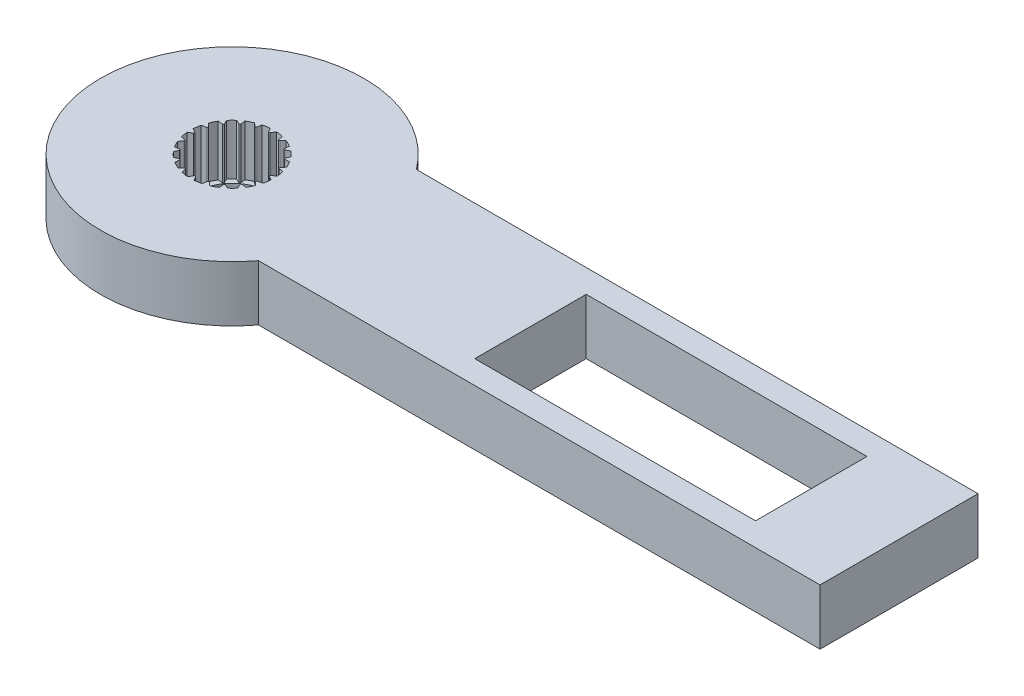
from build123d import *

# Parameters (mm, degrees)
SKETCH1_R             = 2
SKETCH1_W             = 16
SKETCH1_H             = 6.35
BOSS_EXTRUDE1_DEPTH   = 3.175
INDENT2_START         = 0.275
INDENT2_OUTLINE_R     = 2
INDENT2_DEPTH         = 2.9
INDENT2_2_OUTLINE_R   = 2.075
INDENT2_2_OUTLINE_R_2 = 2
INDENT2_2_DEPTH       = 0.275
FILLET4_R             = 0.05


# Read off the part's stored shape, not the designer's step: Indent2
with BuildPart() as part:
    # Sketch1 → Boss-Extrude1 (new body)
    with BuildSketch(Plane(origin=(0, 0, 0), x_dir=(1, 0, 0), z_dir=(0, 1, 0))):
        with BuildLine():
            Line((6, 4.5), (38, 4.5))
            Line((38, 4.5), (38, -4.5))
            Line((38, -4.5), (6, -4.5))
            ThreePointArc((6, -4.5), (-7.5, 0), (6, 4.5))
        make_face()
        with Locations(Location((0, 0, 0), (0, 0, 270))):
            Circle(SKETCH1_R, mode=Mode.SUBTRACT)
        with Locations((25, 0)):
            Rectangle(SKETCH1_W, SKETCH1_H, mode=Mode.SUBTRACT)
    extrude(amount=BOSS_EXTRUDE1_DEPTH)

    # Indent2 outline → Indent2 (cut)
    with BuildSketch(Plane(origin=(0, 0, 0), x_dir=(1, 0, 0), z_dir=(0, 1, 0)).offset(INDENT2_START)):
        with BuildLine():
            Line((1.973202198, -0.621873827), (2.310555802, -0.549506038))
            ThreePointArc((2.310555802, -0.549506038), (2.348957068, -0.350750187), (2.370293408, -0.149446173))
            Line((2.370293408, -0.149446173), (2.068796389, 0.018315857))
            Line((2.068796389, 0.018315857), (2.367275856, 0.191389711))
            ThreePointArc((2.367275856, 0.191389711), (2.342378694, 0.392284402), (2.300464399, 0.590329188))
            Line((2.300464399, 0.590329188), (1.961882375, 0.656712657))
            Line((1.961882375, 0.656712657), (2.192270455, 0.913550902))
            ThreePointArc((2.192270455, 0.913550902), (2.106511974, 1.096919461), (2.005449906, 1.272319015))
            Line((2.005449906, 1.272319015), (1.662925646, 1.230825847))
            Line((1.662925646, 1.230825847), (1.802670348, 1.546287365))
            ThreePointArc((1.802670348, 1.546287365), (1.664445185, 1.6941804), (1.514128003, 1.829765392))
            Line((1.514128003, 1.829765392), (1.201190168, 1.684457227))
            Line((1.201190168, 1.684457227), (1.236612307, 2.027662448))
            ThreePointArc((1.236612307, 2.027662448), (1.059450904, 2.125603157), (0.874592702, 2.208101584))
            Line((0.874592702, 2.208101584), (0.621873827, 1.973202197))
            Line((0.621873827, 1.973202197), (0.549506038, 2.310555802))
            ThreePointArc((0.549506038, 2.310555802), (0.350750187, 2.348957068), (0.149446173, 2.370293408))
            Line((0.149446173, 2.370293408), (-0.018315857, 2.068796389))
            Line((-0.018315857, 2.068796389), (-0.191389711, 2.367275856))
            ThreePointArc((-0.191389711, 2.367275856), (-0.392284402, 2.342378694), (-0.590329188, 2.300464399))
            Line((-0.590329188, 2.300464399), (-0.656712657, 1.961882375))
            Line((-0.656712657, 1.961882375), (-0.913550902, 2.192270455))
            ThreePointArc((-0.913550902, 2.192270455), (-1.096919461, 2.106511974), (-1.272319015, 2.005449905))
            Line((-1.272319015, 2.005449905), (-1.230825847, 1.662925646))
            Line((-1.230825847, 1.662925646), (-1.546287365, 1.802670348))
            ThreePointArc((-1.546287365, 1.802670348), (-1.6941804, 1.664445185), (-1.829765392, 1.514128003))
            Line((-1.829765392, 1.514128003), (-1.684457227, 1.201190168))
            Line((-1.684457227, 1.201190168), (-2.027662448, 1.236612307))
            ThreePointArc((-2.027662448, 1.236612307), (-2.125603157, 1.059450904), (-2.208101584, 0.874592702))
            Line((-2.208101584, 0.874592702), (-1.973202197, 0.621873827))
            Line((-1.973202197, 0.621873827), (-2.310555802, 0.549506038))
            ThreePointArc((-2.310555802, 0.549506038), (-2.348957068, 0.350750187), (-2.370293408, 0.149446173))
            Line((-2.370293408, 0.149446173), (-2.068796389, -0.018315857))
            Line((-2.068796389, -0.018315857), (-2.367275856, -0.191389711))
            ThreePointArc((-2.367275856, -0.191389711), (-2.342378694, -0.392284402), (-2.300464399, -0.590329188))
            Line((-2.300464399, -0.590329188), (-1.961882375, -0.656712657))
            Line((-1.961882375, -0.656712657), (-2.192270455, -0.913550902))
            ThreePointArc((-2.192270455, -0.913550902), (-2.106511974, -1.096919461), (-2.005449905, -1.272319015))
            Line((-2.005449905, -1.272319015), (-1.662925646, -1.230825847))
            Line((-1.662925646, -1.230825847), (-1.802670348, -1.546287365))
            ThreePointArc((-1.802670348, -1.546287365), (-1.664445185, -1.6941804), (-1.514128003, -1.829765392))
            Line((-1.514128003, -1.829765392), (-1.201190168, -1.684457227))
            Line((-1.201190168, -1.684457227), (-1.236612307, -2.027662448))
            ThreePointArc((-1.236612307, -2.027662448), (-1.059450904, -2.125603157), (-0.874592702, -2.208101584))
            Line((-0.874592702, -2.208101584), (-0.621873827, -1.973202198))
            Line((-0.621873827, -1.973202198), (-0.549506038, -2.310555802))
            ThreePointArc((-0.549506038, -2.310555802), (-0.350750187, -2.348957068), (-0.149446173, -2.370293408))
            Line((-0.149446173, -2.370293408), (0.018315857, -2.068796389))
            Line((0.018315857, -2.068796389), (0.191389711, -2.367275856))
            ThreePointArc((0.191389711, -2.367275856), (0.392284402, -2.342378694), (0.590329188, -2.300464399))
            Line((0.590329188, -2.300464399), (0.656712657, -1.961882375))
            Line((0.656712657, -1.961882375), (0.913550902, -2.192270455))
            ThreePointArc((0.913550902, -2.192270455), (1.096919461, -2.106511974), (1.272319015, -2.005449906))
            Line((1.272319015, -2.005449906), (1.230825847, -1.662925646))
            Line((1.230825847, -1.662925646), (1.546287365, -1.802670348))
            ThreePointArc((1.546287365, -1.802670348), (1.6941804, -1.664445185), (1.829765392, -1.514128003))
            Line((1.829765392, -1.514128003), (1.684457227, -1.201190168))
            Line((1.684457227, -1.201190168), (2.027662448, -1.236612307))
            ThreePointArc((2.027662448, -1.236612307), (2.125603157, -1.059450904), (2.208101584, -0.874592702))
            Line((2.208101584, -0.874592702), (1.973202198, -0.621873827))
        make_face()
        Circle(INDENT2_OUTLINE_R, mode=Mode.SUBTRACT)
    extrude(amount=INDENT2_DEPTH, mode=Mode.SUBTRACT)

    # Indent2 2 outline → Indent2 2 (cut)
    with BuildSketch(Plane(origin=(0, 0, 0), x_dir=(1, 0, 0), z_dir=(0, 1, 0))):
        Circle(INDENT2_2_OUTLINE_R)
        Circle(INDENT2_2_OUTLINE_R_2, mode=Mode.SUBTRACT)
    extrude(amount=INDENT2_2_DEPTH, mode=Mode.SUBTRACT)

    # Fillet4
    # the kernel refuses this fillet: 0.05 mm, written as the material it takes off along each edge
    with BuildSketch(Plane(origin=(2.068796389, 0.275, -0.018315857), x_dir=(0.8650868282896619, 0, -0.501622148155096), z_dir=(0, 1, 0)), Plane(origin=(1.961882375, 0.275, -0.656712657), x_dir=(0.6677366959947866, 0, -0.7443975448790559), z_dir=(0, 1, 0)), Plane(origin=(0.621873827, 0.275, -1.973202197), x_dir=(-0.20974448107145283, 0, -0.9777562337618038), z_dir=(0, 1, 0)), Plane(origin=(-0.018315857, 0.275, -2.068796389), x_dir=(-0.501622148155096, 0, -0.8650868282896619), z_dir=(0, 1, 0)), Plane(origin=(-0.656712657, 0.275, -1.961882375), x_dir=(-0.7443975448790559, 0, -0.6677366959947866), z_dir=(0, 1, 0)), Plane(origin=(-1.973202197, 0.275, -0.621873827), x_dir=(-0.9777562337618038, 0, 0.20974448107145283), z_dir=(0, 1, 0)), Plane(origin=(-2.068796389, 0.275, 0.018315857), x_dir=(-0.8650868282896619, 0, 0.501622148155096), z_dir=(0, 1, 0)), Plane(origin=(-1.961882375, 0.275, 0.656712657), x_dir=(-0.6677366959947866, 0, 0.7443975448790559), z_dir=(0, 1, 0)), Plane(origin=(0.018315857, 0.275, 2.068796389), x_dir=(0.501622148155096, 0, 0.8650868282896619), z_dir=(0, 1, 0)), Plane(origin=(0.656712657, 0.275, 1.961882375), x_dir=(0.7443975448790559, 0, 0.6677366959947866), z_dir=(0, 1, 0))) as fillet4_piece_1:
        with BuildLine():
            CenterArc((FILLET4_R * 1.76030903483, -FILLET4_R), FILLET4_R, 90, 120.799739684)
            Line((FILLET4_R * 0.901346811508, -FILLET4_R * 1.51203896229), (0, 0))
            Line((0, 0), (FILLET4_R * 1.76030903483, 0))
        make_face()
    extrude(amount=3.120038629, mode=Mode.SUBTRACT)
    with BuildSketch(Plane(origin=(1.662925646, 0.275, -1.230825847), x_dir=(0.40502384395389723, 0, -0.9143061226027139), z_dir=(0, 1, 0)), Plane(origin=(-1.230825847, 0.275, -1.662925646), x_dir=(-0.9143061226027142, 0, -0.40502384395389696), z_dir=(0, 1, 0)), Plane(origin=(-1.662925646, 0.275, 1.230825847), x_dir=(-0.40502384395389696, 0, 0.9143061226027142), z_dir=(0, 1, 0)), Plane(origin=(-0.621873827, 0.275, 1.973202198), x_dir=(0.20974448166583565, 0, 0.977756233634299), z_dir=(0, 1, 0)), Plane(origin=(1.230825847, 0.275, 1.662925646), x_dir=(0.9143061226027139, 0, 0.40502384395389723), z_dir=(0, 1, 0)), Plane(origin=(1.973202198, 0.275, 0.621873827), x_dir=(0.977756233634299, 0, -0.20974448166583565), z_dir=(0, 1, 0))) as fillet4_piece_2:
        with BuildLine():
            CenterArc((FILLET4_R * 1.76030903185, -FILLET4_R), FILLET4_R, 90, 120.799739601)
            Line((FILLET4_R * 0.901346807787, -FILLET4_R * 1.51203896104), (0, 0))
            Line((0, 0), (FILLET4_R * 1.76030903185, 0))
        make_face()
    extrude(amount=3.120038629, mode=Mode.SUBTRACT)
    with BuildSketch(Plane(origin=(1.201190168, 0.275, -1.684457227), x_dir=(0.10266443492130879, 0, -0.9947160468205429), z_dir=(0, 1, 0)), Plane(origin=(-1.684457227, 0.275, -1.201190168), x_dir=(-0.9947160468205429, 0, -0.10266443492130879), z_dir=(0, 1, 0)), Plane(origin=(-1.201190168, 0.275, 1.684457227), x_dir=(-0.10266443492130879, 0, 0.9947160468205429), z_dir=(0, 1, 0)), Plane(origin=(1.684457227, 0.275, 1.201190168), x_dir=(0.9947160468205429, 0, 0.10266443492130879), z_dir=(0, 1, 0))) as fillet4_piece_3:
        with BuildLine():
            CenterArc((FILLET4_R * 1.7603090297, -FILLET4_R), FILLET4_R, 90, 120.799739541)
            Line((FILLET4_R * 0.901346805096, -FILLET4_R * 1.51203896014), (0, 0))
            Line((0, 0), (FILLET4_R * 1.7603090297, 0))
        make_face()
    extrude(amount=3.120038629, mode=Mode.SUBTRACT)


solid = part.part
